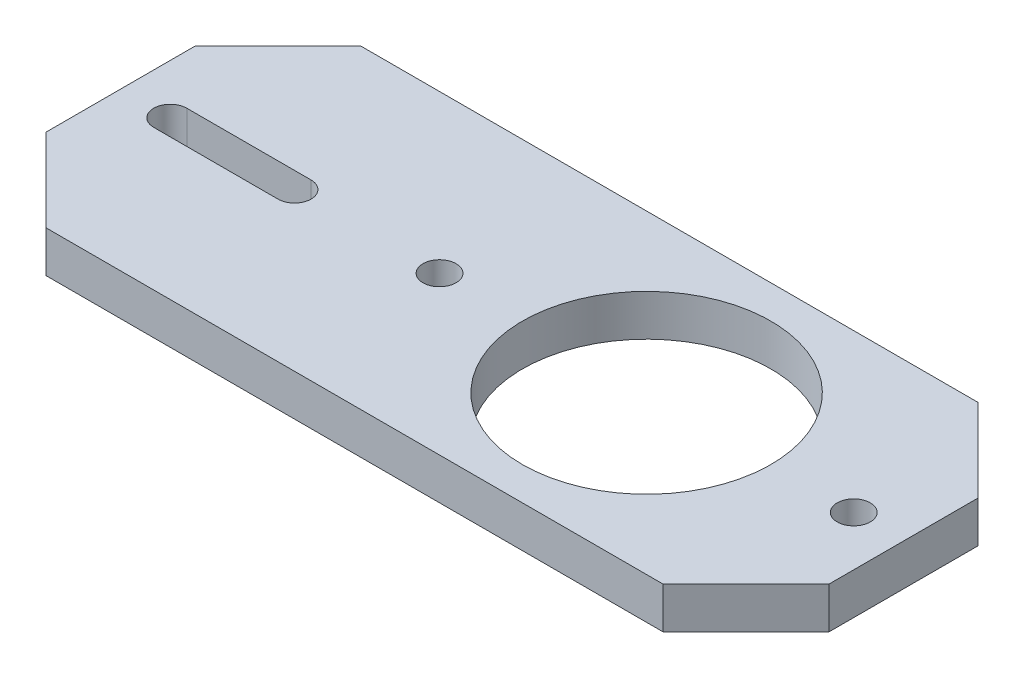
from build123d import *

# Parameters (mm, degrees)
SKETCH1_R           = 2
SKETCH1_R_2         = 15
BOSS_EXTRUDE1_DEPTH = 5


with BuildPart() as part:
    # Sketch1 → Boss-Extrude1 (new body)
    with BuildSketch(Plane(origin=(0, 0, 0), x_dir=(1, 0, 0), z_dir=(0, 1, 0))):
        Polygon((-63.5, 9), (-53.5, 19), (21, 19), (31, 9), (31, -9), (21, -19), (-53.5, -19), (-63.5, -9), align=None)
        with Locations((-25, 0)):
            Circle(SKETCH1_R, mode=Mode.SUBTRACT)
        with Locations((25, 0)):
            Circle(SKETCH1_R, mode=Mode.SUBTRACT)
        Circle(SKETCH1_R_2, mode=Mode.SUBTRACT)
        with BuildLine():
            Line((-57.5, 2), (-42.5, 2))
            ThreePointArc((-42.5, 2), (-40.5, 0), (-42.5, -2))
            Line((-42.5, -2), (-57.5, -2))
            ThreePointArc((-57.5, -2), (-59.5, 0), (-57.5, 2))
        make_face(mode=Mode.SUBTRACT)
    extrude(amount=-BOSS_EXTRUDE1_DEPTH)


solid = part.part
